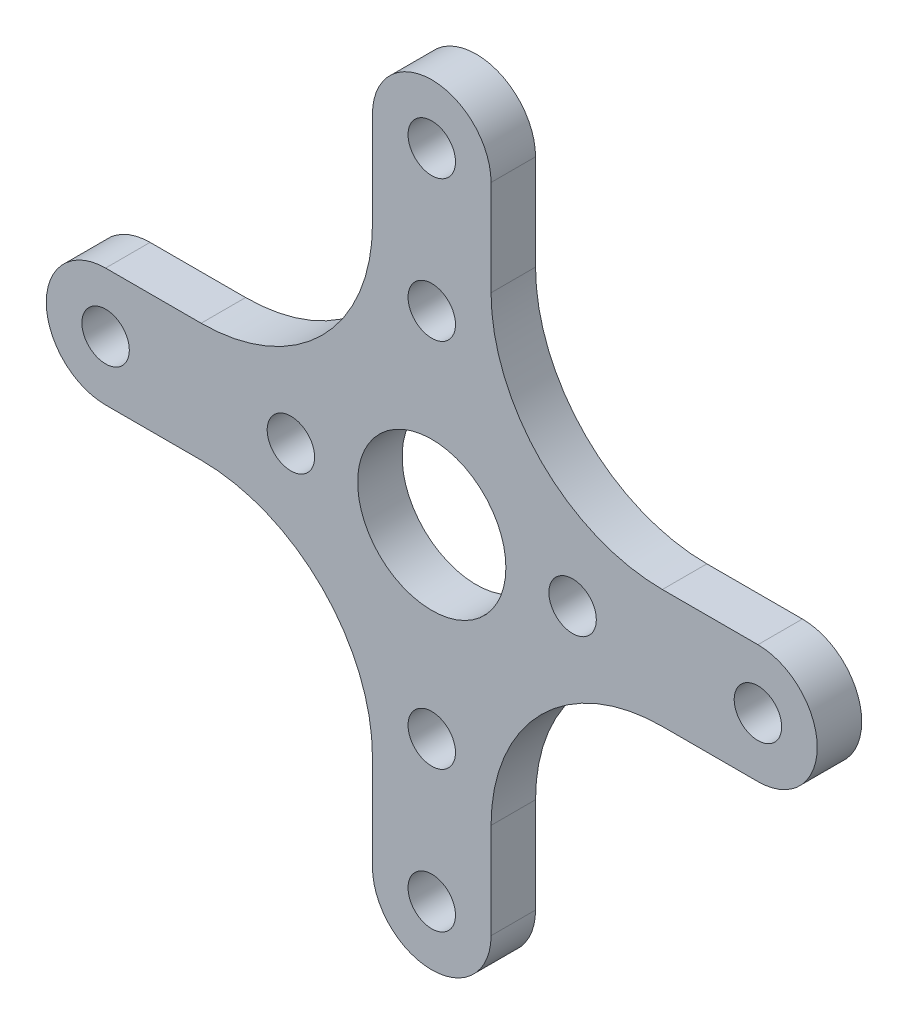
from build123d import *

# Parameters (mm, degrees)
SKETCH_1_R      = 1.6
SKETCH_1_R_2    = 5
EXTRUDE_1_DEPTH = 1.5


with BuildPart() as part:
    # Эскиз1 → Бобышка-Вытянуть1 (new, symmetric)
    with BuildSketch(Plane.XY):
        with BuildLine():
            Line((-22, 4), (-15.556349186, 4))
            ThreePointArc((-15.556349186, 4), (-7.384776311, 7.384776311), (-4, 15.556349186))
            Line((-4, 15.556349186), (-4, 22))
            ThreePointArc((-4, 22), (0, 26), (4, 22))
            Line((4, 22), (4, 15.556349186))
            ThreePointArc((4, 15.556349186), (7.384776311, 7.384776311), (15.556349186, 4))
            Line((15.556349186, 4), (22, 4))
            ThreePointArc((22, 4), (26, 0), (22, -4))
            Line((22, -4), (15.556349186, -4))
            ThreePointArc((15.556349186, -4), (7.384776311, -7.384776311), (4, -15.556349186))
            Line((4, -15.556349186), (4, -22))
            ThreePointArc((4, -22), (0, -26), (-4, -22))
            Line((-4, -22), (-4, -15.556349186))
            ThreePointArc((-4, -15.556349186), (-7.384776311, -7.384776311), (-15.556349186, -4))
            Line((-15.556349186, -4), (-22, -4))
            ThreePointArc((-22, -4), (-26, 0), (-22, 4))
        make_face()
        with Locations((0, 22)):
            Circle(SKETCH_1_R, mode=Mode.SUBTRACT)
        with Locations((22, 0)):
            Circle(SKETCH_1_R, mode=Mode.SUBTRACT)
        with Locations((0, -22)):
            Circle(SKETCH_1_R, mode=Mode.SUBTRACT)
        with Locations((-22, 0)):
            Circle(SKETCH_1_R, mode=Mode.SUBTRACT)
        Circle(SKETCH_1_R_2, mode=Mode.SUBTRACT)
        with Locations((-9.5, 0)):
            Circle(SKETCH_1_R, mode=Mode.SUBTRACT)
        with Locations((9.5, 0)):
            Circle(SKETCH_1_R, mode=Mode.SUBTRACT)
        with Locations((0, 12.5)):
            Circle(SKETCH_1_R, mode=Mode.SUBTRACT)
        with Locations((0, -12.5)):
            Circle(SKETCH_1_R, mode=Mode.SUBTRACT)
    extrude(amount=EXTRUDE_1_DEPTH, both=True)


solid = part.part
